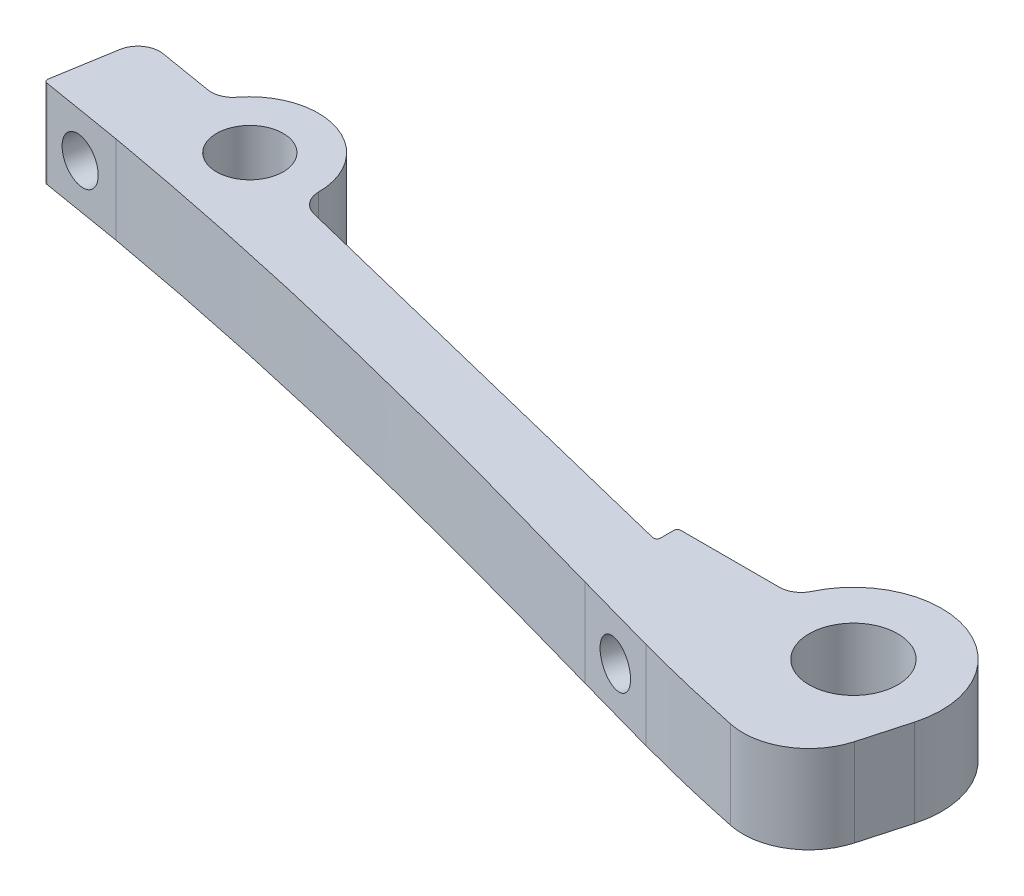
from build123d import *

# Parameters (mm, degrees)
BOSS_EXTRUDE1_DEPTH                   = 6.35
FILLET1_R                             = 3.175
FILLET4_R                             = 0.508
F_1_4_0_25_DIAMETER_HOLE1_D           = 6.35
F_1_4_0_25_DIAMETER_HOLE1_ON_FACE_2_D = 6.35
FILLET8_R                             = 9.525


with BuildPart() as part:
    # Sketch1 → Boss-Extrude1 (new, symmetric)
    # profile 1 of 13: a face of its own
    with BuildSketch(Plane(origin=(0, 0, 0), x_dir=(1, 0, 0), z_dir=(0, 1, 0))):
        Polygon((-63.032869919, 6.829847883), (-50.8, 3.417093343), (-50.117449092, 5.863667327), (-48.008399772, 13.423462702), (-63.032869919, 17.128450878), align=None)
    # profile 2 of 13: a face of its own
    with BuildSketch(Plane(origin=(0, 0, 0), x_dir=(1, 0, 0), z_dir=(0, 1, 0))):
        with BuildLine():
            Line((-50.117449092, 5.863667327), (-50.8, 3.417093343))
            add(Edge.make_bspline(
                [(-50.8, 3.417093343), (-47.90401251, 2.638759622), (-42.323161066, 1.207315918), (-34.243320379, -0.564459364), (-28.828072067, -1.650873486), (-26.114874946, -2.164171794), (-25.868230414, -2.21056185)],
                knots=[0.402881469, 0.402881469, 0.402881469, 0.402881469, 0.417195876, 0.430379519, 0.442362633, 0.443560626, 0.443560626, 0.443560626, 0.443560626], degree=3))
            Line((-25.868230414, -2.21056185), (-25.529380555, -0.995969297))
            Line((-25.529380555, -0.995969297), (-50.117449092, 5.863667327))
        make_face()
    # profile 3 of 13: a face of its own
    with BuildSketch(Plane(origin=(0, 0, 0), x_dir=(1, 0, 0), z_dir=(0, 1, 0))):
        with BuildLine():
            add(Edge.make_bspline(
                [(-142.916964795, 26.637840254), (-139.851770269, 26.044031657), (-132.224118107, 24.507766264), (-120.204077857, 21.875031645), (-107.039843971, 18.731571582), (-94.42881917, 15.508074422), (-82.464130524, 12.283599717), (-72.07374601, 9.383281264), (-65.6770572, 7.577167824), (-63.032869919, 6.829847883)],
                knots=[0.2516695, 0.2516695, 0.2516695, 0.2516695, 0.266573311, 0.288810349, 0.310405036, 0.331177743, 0.350943876, 0.3695564, 0.382673151, 0.382673151, 0.382673151, 0.382673151], degree=3))
            Line((-63.032869919, 6.829847883), (-63.032869919, 17.128450878))
            Line((-63.032869919, 17.128450878), (-131.41505653, 33.991287994))
            ThreePointArc((-131.41505653, 33.991287994), (-135.697076354, 28.016927932), (-142.916964795, 26.637840254))
        make_face()
    # profile 4 of 13: a face of its own
    with BuildSketch(Plane(origin=(0, 0, 0), x_dir=(1, 0, 0), z_dir=(0, 1, 0))):
        with BuildLine():
            Line((-48.008399772, 13.423462702), (-50.117449092, 5.863667327))
            Line((-50.117449092, 5.863667327), (-25.529380555, -0.995969297))
            Line((-25.529380555, -0.995969297), (-21.592172885, 13.116780012))
            ThreePointArc((-21.592172885, 13.116780012), (-33.805570634, 3.783353047), (-46.135923457, 12.961715796))
            Line((-46.135923457, 12.961715796), (-48.008399772, 13.423462702))
        make_face()
    # profile 5 of 13: a face of its own
    with BuildSketch(Plane(origin=(0, 0, 0), x_dir=(1, 0, 0), z_dir=(0, 1, 0))):
        Polygon((-63.032869919, 20.214556587), (-63.032869919, 17.128450878), (-48.008399772, 13.423462702), (-46.180241275, 19.976417164), (-46.113804584, 20.214556587), align=None)
    # profile 6 of 13: a face of its own
    with BuildSketch(Plane(origin=(0, 0, 0), x_dir=(1, 0, 0), z_dir=(0, 1, 0))):
        with BuildLine():
            add(Edge.make_bspline(
                [(-152.4, 28.398178215), (-150.835767653, 28.120675984), (-147.672379647, 27.546477658), (-144.513670254, 26.947163992), (-142.916964795, 26.637840254)],
                knots=[0.236322429, 0.236322429, 0.236322429, 0.236322429, 0.243905882, 0.2516695, 0.2516695, 0.2516695, 0.2516695], degree=3))
            ThreePointArc((-142.916964795, 26.637840254), (-149.167660925, 30.710139705), (-150.804662589, 37.988535853))
            Line((-150.804662589, 37.988535853), (-152.4, 28.398178215))
        make_face()
    # profile 7 of 13: a face of its own
    with BuildSketch(Plane(origin=(0, 0, 0), x_dir=(1, 0, 0), z_dir=(0, 1, 0))):
        with BuildLine():
            ThreePointArc((-150.804662589, 37.988535853), (-149.167660925, 30.710139705), (-142.916964795, 26.637840254))
            ThreePointArc((-142.916964795, 26.637840254), (-135.697076354, 28.016927932), (-131.41505653, 33.991287994))
            ThreePointArc((-131.41505653, 33.991287994), (-131.199232943, 35.168440277), (-131.126940024, 36.363028513))
            ThreePointArc((-131.126940024, 36.363028513), (-138.72556699, 45.996556718), (-149.864041918, 40.850842606))
            ThreePointArc((-149.864041918, 40.850842606), (-150.443809774, 39.45565952), (-150.804662589, 37.988535853))
        make_face()
        with BuildLine():
            ThreePointArc((-136.206940024, 36.363028513), (-136.242159651, 35.781049629), (-136.347304475, 35.207565183))
            ThreePointArc((-136.347304475, 35.207565183), (-145.823720397, 36.945007397), (-136.206940024, 36.363028513))
        make_face(mode=Mode.SUBTRACT)
    # profile 8 of 13: a face of its own
    with BuildSketch(Plane(origin=(0, 0, 0), x_dir=(1, 0, 0), z_dir=(0, 1, 0))):
        with BuildLine():
            Line((-46.180241275, 19.976417164), (-48.008399772, 13.423462702))
            Line((-48.008399772, 13.423462702), (-46.135923457, 12.961715796))
            ThreePointArc((-46.135923457, 12.961715796), (-46.649452433, 16.465962078), (-46.180241275, 19.976417164))
        make_face()
    # profile 9 of 13: a face of its own
    with BuildSketch(Plane(origin=(0, 0, 0), x_dir=(1, 0, 0), z_dir=(0, 1, 0))):
        with BuildLine():
            Line((-152.4, 28.398178215), (-150.804662589, 37.988535853))
            Line((-150.804662589, 37.988535853), (-150.316016511, 40.926027704))
            Line((-150.316016511, 40.926027704), (-162.843866, 43.010011192))
            Line((-162.843866, 43.010011192), (-164.927849489, 30.482161703))
            add(Edge.make_bspline(
                [(-164.927849489, 30.482161703), (-163.914067431, 30.324847033), (-159.732455899, 29.664434578), (-155.558182899, 28.958454826), (-152.4, 28.398178215)],
                knots=[0.216114261, 0.216114261, 0.216114261, 0.216114261, 0.221011446, 0.236322429, 0.236322429, 0.236322429, 0.236322429], degree=3))
        make_face()
    # profile 10 of 13: a face of its own
    with BuildSketch(Plane(origin=(0, 0, 0), x_dir=(1, 0, 0), z_dir=(0, 1, 0))):
        with BuildLine():
            Line((-150.316016511, 40.926027704), (-150.804662589, 37.988535853))
            ThreePointArc((-150.804662589, 37.988535853), (-150.443809774, 39.45565952), (-149.864041918, 40.850842606))
            Line((-149.864041918, 40.850842606), (-150.316016511, 40.926027704))
        make_face()
    # profile 11 of 13: a face of its own
    with BuildSketch(Plane(origin=(0, 0, 0), x_dir=(1, 0, 0), z_dir=(0, 1, 0))):
        with BuildLine():
            Line((-164.927849489, 30.482161703), (-152.4, 28.398178215))
            add(Edge.make_bspline(
                [(-164.927849489, 30.482161703), (-163.914067431, 30.324847033), (-159.732455899, 29.664434578), (-155.558182899, 28.958454826), (-152.4, 28.398178215)],
                knots=[0.216114261, 0.216114261, 0.216114261, 0.216114261, 0.221011446, 0.236322429, 0.236322429, 0.236322429, 0.236322429], degree=3))
        make_face()
    # profile 12 of 13: a face of its own
    with BuildSketch(Plane(origin=(0, 0, 0), x_dir=(1, 0, 0), z_dir=(0, 1, 0))):
        with BuildLine():
            Line((-46.113804584, 20.214556587), (-46.180241275, 19.976417164))
            ThreePointArc((-46.180241275, 19.976417164), (-46.14635129, 20.095654256), (-46.111304881, 20.214556587))
            Line((-46.111304881, 20.214556587), (-46.113804584, 20.214556587))
        make_face()
    # profile 13 of 13: a face of its own
    with BuildSketch(Plane(origin=(0, 0, 0), x_dir=(1, 0, 0), z_dir=(0, 1, 0))):
        with BuildLine():
            ThreePointArc((-46.111304881, 20.214556587), (-46.14635129, 20.095654256), (-46.180241275, 19.976417164))
            ThreePointArc((-46.180241275, 19.976417164), (-46.649452433, 16.465962078), (-46.135923457, 12.961715796))
            ThreePointArc((-46.135923457, 12.961715796), (-33.805570634, 3.783353047), (-21.592172885, 13.116780012))
            ThreePointArc((-21.592172885, 13.116780012), (-21.240618227, 14.815698867), (-21.122707154, 16.546598324))
            ThreePointArc((-21.122707154, 16.546598324), (-32.032575932, 29.17478044), (-46.111304881, 20.214556587))
        make_face()
        with BuildLine():
            ThreePointArc((-27.472707154, 16.546598324), (-29.931164004, 11.497775102), (-35.421757105, 10.319635293))
            ThreePointArc((-35.421757105, 10.319635293), (-37.841250304, 21.595421547), (-27.472707154, 16.546598324))
        make_face(mode=Mode.SUBTRACT)
    extrude(amount=BOSS_EXTRUDE1_DEPTH, both=True)

    # Fillet1
    # the kernel refuses this fillet: 3.175 mm, written as the material it adds along each edge
    with BuildSketch(Plane(origin=(-149.864041918, 6.35, -40.850842606), x_dir=(0.5331827682272952, 0, -0.8460000801805391), z_dir=(0, -1, 0))) as fillet1_piece_1:
        with BuildLine():
            CenterArc((2.116076272, -3.161518606), FILLET1_R, 95.281860793, 61.941944222)
            Line((-0.811350167, -1.932372788), (0, 0))
            ThreePointArc((0, 0), (0.911900272, -0.042061948), (1.823800544, 0))
        make_face()
    extrude(amount=12.7)
    with BuildSketch(Plane(origin=(-131.41505653, -6.35, -33.991287994), x_dir=(0.9709149499625199, 0, 0.23942464355048618), z_dir=(0, 1, 0))) as fillet1_piece_2:
        with BuildLine():
            CenterArc((2.783835933, 3.175), FILLET1_R, 194.047041006, 75.952958994)
            ThreePointArc((-0.296221332, 2.404368932), (-0.074334234, 1.211273817), (0, 0))
            Line((0, 0), (2.783835933, 0))
        make_face()
    extrude(amount=12.7)
    with BuildSketch(Plane(origin=(-46.111304881, 6.35, -20.214556587), x_dir=(-1, 0, 0), z_dir=(0, -1, 0)), Plane(origin=(-46.111304881, 0, -20.214556587), x_dir=(-1, 0, 0), z_dir=(0, -1, 0))) as fillet1_piece_3:
        with BuildLine():
            CenterArc((2.169682732, 3.175), FILLET1_R, 205.425374389, 64.574625611)
            ThreePointArc((-0.697803415, 1.811860904), (-0.314399096, 0.91921847), (0, 0))
            Line((0, 0), (2.169682732, 0))
        make_face()
    extrude(amount=6.35)
    # the kernel refuses this fillet: 3.175 mm, written as the material it takes off along each edge
    with BuildSketch(Plane(origin=(-162.843866, 14.2875, -43.010011192), x_dir=(-0.16409318808875556, 0, 0.9864448416525216), z_dir=(0, -1, 0))) as fillet1_2_piece_1:
        with BuildLine():
            CenterArc((FILLET1_R, -FILLET1_R), FILLET1_R, 90, 90)
            Line((0, -FILLET1_R), (0, 0))
            Line((0, 0), (FILLET1_R, 0))
        make_face()
    extrude(amount=28.575, mode=Mode.SUBTRACT)

    # Fillet4
    fillet4_edges = [part.edges().sort_by_distance(p)[0] for p in [
        (-164.927849489, 0, -30.482161703),
        (-63.032869919, 0, -17.128450878),
        (-63.032869919, 0, -20.214556587),
    ]]
    fillet(fillet4_edges, radius=FILLET4_R)

    # 1/4 (0.25) Diameter Hole1 (through all)
    with Locations(Plane(origin=(-56.916434959, 0, -5.123470613), x_dir=(0.963218103856, 0, 0.268720829868), z_dir=(-0.268720829868, 0, 0.963218103856))):
        with Locations((0, 0)):
            Hole(F_1_4_0_25_DIAMETER_HOLE1_D / 2)

    # 1/4 (0.25) Diameter Hole1 on face 2 (through all)
    with Locations(Plane(origin=(-158.663924744, 0, -29.440169959), x_dir=(0.986444876362, 0, 0.164092979433), z_dir=(-0.164092979433, 0, 0.986444876362))):
        with Locations((0, 0)):
            Hole(F_1_4_0_25_DIAMETER_HOLE1_ON_FACE_2_D / 2)

    # Fillet8
    fillet8_edges = [part.edges().sort_by_distance(p)[0] for p in [
        (-25.868230414, -3.175, 2.21056185),
    ]]
    fillet(fillet8_edges, radius=FILLET8_R)


solid = part.part
